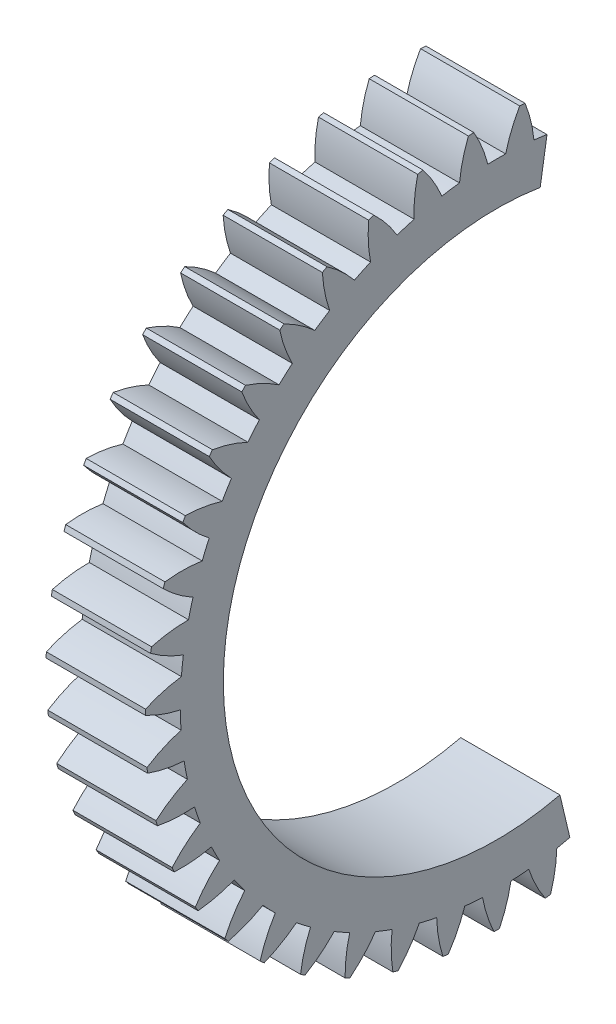
from build123d import *

# Parameters (mm, degrees)
BASPROSKE_W                = 12.7
BASPROSKE_H                = 45
TOOTHCUT_DEPTH             = 65.894452768
TEETHCUTS_COUNT            = 43
BORSKE_R                   = 35
BORE_DEPTH                 = 50.001524
WYTNIJ_WYCI_GNI_CIE2_DEPTH = 65.881417789


with BuildPart() as part:
    # BasProSke → Base-Revolve (revolve)
    with BuildSketch(Plane(origin=(0, 0, 0), x_dir=(1, 0, 0), z_dir=(0, 1, 0))):
        with Locations((6.35, 22.5)):
            Rectangle(BASPROSKE_W, BASPROSKE_H)
    revolve(axis=Axis((-10, 0, 0), (1, 0, 0)))

    # TooCutSke → ToothCut (cut, through all)
    with BuildSketch(Plane(origin=(0, 0, 0), x_dir=(0, 0, -1), z_dir=(1, 0, 0))):
        with BuildLine():
            ThreePointArc((1.141464053, 40.482640618), (0, 40.49873), (-1.141464053, 40.482640618))
            ThreePointArc((-1.141464053, 40.482640618), (-1.89324119, 42.769087835), (-2.956825759, 44.928207471))
            ThreePointArc((-2.956825759, 44.928207471), (0, 45.0254), (2.956825759, 44.928207471))
            ThreePointArc((2.956825759, 44.928207471), (1.89324119, 42.769087835), (1.141464053, 40.482640618))
        make_face()
    toothcut = extrude(amount=TOOTHCUT_DEPTH, mode=Mode.SUBTRACT)

    # TeethCuts: ToothCut ×43 about axis
    teethcuts_axis = Axis((-10, 0, 0), (1, 0, 0))
    for i in range(1, TEETHCUTS_COUNT):
        add(toothcut.rotate(teethcuts_axis, i * 360 / TEETHCUTS_COUNT), mode=Mode.SUBTRACT)

    # BorSke → Bore (cut, symmetric)
    with BuildSketch(Plane(origin=(0, 0, 0), x_dir=(0, 0, -1), z_dir=(1, 0, 0))):
        Circle(BORSKE_R)
    extrude(amount=BORE_DEPTH, both=True, mode=Mode.SUBTRACT)

    # Szkic2 → Wytnij-wyciągnięcie2 (cut, through all)
    with BuildSketch(Plane(origin=(0, 0, 0), x_dir=(0, 0, -1), z_dir=(1, 0, 0))):
        Polygon((4.641350643, 28.827807813), (6.249446703, -26.30622421), (10.919986137, -45.966245864), (68.2286098, -47.979903604), (54.053229084, 56.074326501), (14.554160093, 57.462208479), (7.470376125, 46.399116076), align=None)
    extrude(amount=WYTNIJ_WYCI_GNI_CIE2_DEPTH, mode=Mode.SUBTRACT)


solid = part.part
